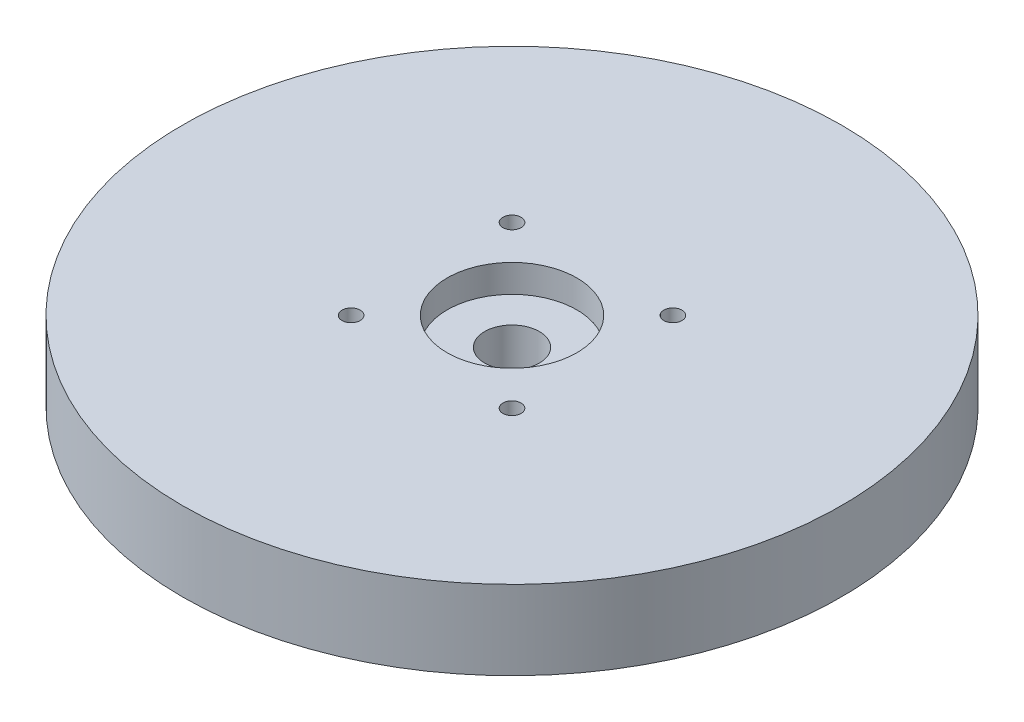
from build123d import *

# Parameters (mm, degrees)
SKETCH2_R           = 63.5
BOSS_EXTRUDE1_DEPTH = 15.24
SKETCH3_R           = 5.2705
CUT_EXTRUDE3_DEPTH  = 92.086539071
SKETCH4_R           = 1.75
CUT_EXTRUDE4_DEPTH  = 55.626
SKETCH5_R           = 12.5
CUT_EXTRUDE5_DEPTH  = 5.334


with BuildPart() as part:
    # Sketch2 → Boss-Extrude1 (new body)
    with BuildSketch(Plane(origin=(0, 0, 0), x_dir=(1, 0, 0), z_dir=(0, 1, 0))):
        Circle(SKETCH2_R)
    extrude(amount=BOSS_EXTRUDE1_DEPTH)

    # Sketch3 → Cut-Extrude3 (cut, through all)
    with BuildSketch(Plane(origin=(0, 15.24, 0), x_dir=(1, 0, 0), z_dir=(0, 1, 0))):
        Circle(SKETCH3_R)
    extrude(amount=-CUT_EXTRUDE3_DEPTH, mode=Mode.SUBTRACT)

    # Sketch4 → Cut-Extrude4 (cut)
    with BuildSketch(Plane(origin=(0, 15.24, 0), x_dir=(1, 0, 0), z_dir=(0, 1, 0))):
        with Locations((-15.5, 15.5)):
            Circle(SKETCH4_R)
        with Locations((15.5, 15.5)):
            Circle(SKETCH4_R)
        with Locations((15.5, -15.5)):
            Circle(SKETCH4_R)
        with Locations((-15.5, -15.5)):
            Circle(SKETCH4_R)
    extrude(amount=-CUT_EXTRUDE4_DEPTH, mode=Mode.SUBTRACT)

    # Sketch5 → Cut-Extrude5 (cut)
    with BuildSketch(Plane(origin=(0, 15.24, 0), x_dir=(1, 0, 0), z_dir=(0, 1, 0))):
        Circle(SKETCH5_R)
    extrude(amount=-CUT_EXTRUDE5_DEPTH, mode=Mode.SUBTRACT)


solid = part.part
